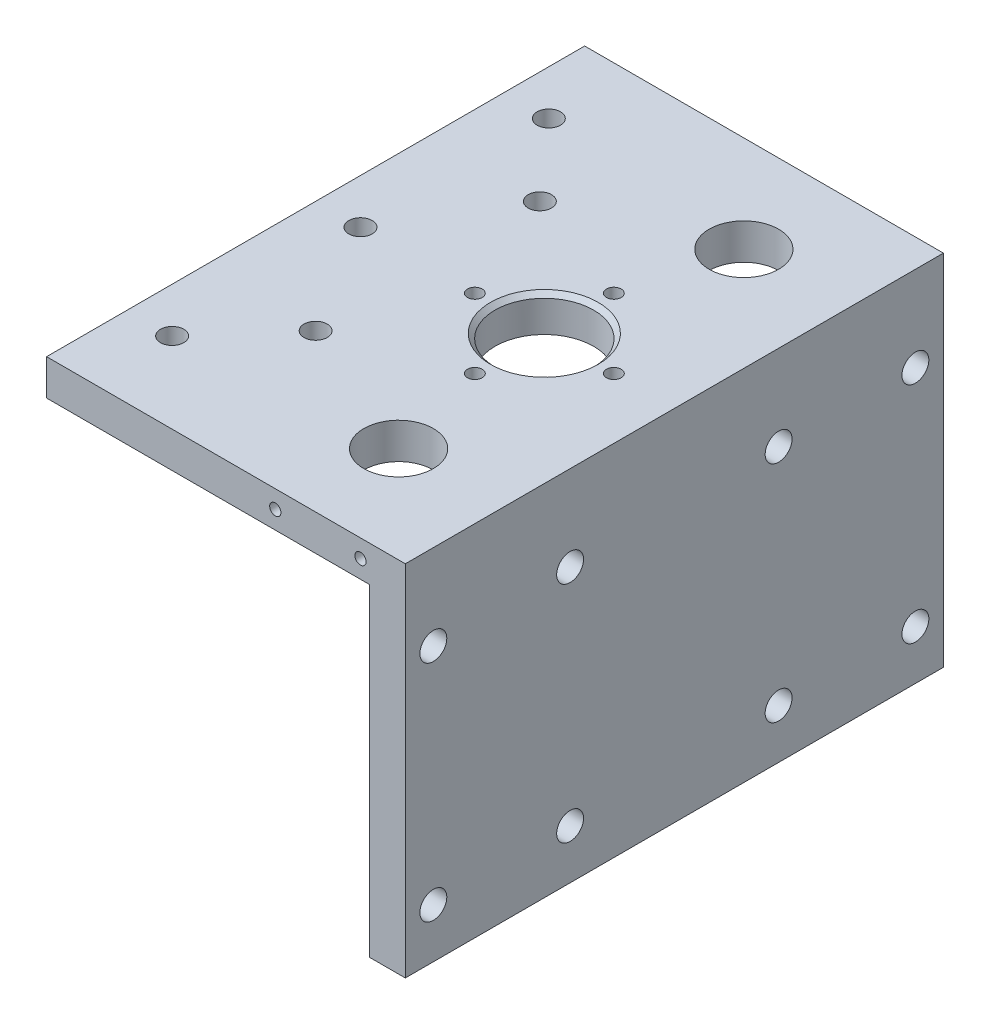
from build123d import *

# Parameters (mm, degrees)
ESTRUSIONE_ESTRUSIONE1_DEPTH = 120
TAGLIO_ESTRUSIONE2_REACH     = 166.924
SCHIZZO6_R                   = 7.75
TAGLIO_ESTRUSIONE3_REACH     = 166.924
SCHIZZO7_R                   = 11
M4_TAPPED_HOLE1_D            = 3.3
SCHIZZO12_R                  = 3
TAGLIO_ESTRUSIONE4_DEPTH     = 10
SCHIZZO14_R                  = 2.6
TAGLIO_ESTRUSIONE5_DEPTH     = 10
SMUSSO2_SIZE                 = 1
FORO_FILETTATO_M3_1_D        = 2.5
FORO_FILETTATO_M3_1_DEPTH    = 10
FORO_FILETTATO_M3_1_TIP      = 0.751075774


with BuildPart() as part:
    # Schizzo1 → Estrusione-Estrusione1 (new body)
    with BuildSketch(Plane.XY):
        Polygon((0, 0), (-80, 0), (-80, -8), (-8, -8), (-8, -80), (0, -80), align=None)
    extrude(amount=ESTRUSIONE_ESTRUSIONE1_DEPTH)

    # Schizzo6 → Taglio-Estrusione2 (cut, up to next)
    with BuildSketch(Plane(origin=(0, 0, 0), x_dir=(1, 0, 0), z_dir=(0, 1, 0)), mode=Mode.PRIVATE) as taglio_estrusione2_sk1:
        with Locations((-23, -21.5)):
            Circle(SCHIZZO6_R)
    taglio_estrusione2_tool1 = extrude(taglio_estrusione2_sk1.sketch, amount=-TAGLIO_ESTRUSIONE2_REACH, mode=Mode.PRIVATE) & part.part
    # Schizzo6 → Taglio-Estrusione2 (cut, up to next)
    with BuildSketch(Plane(origin=(0, 0, 0), x_dir=(1, 0, 0), z_dir=(0, 1, 0)), mode=Mode.PRIVATE) as taglio_estrusione2_sk2:
        with Locations((-23, -98.5)):
            Circle(SCHIZZO6_R)
    taglio_estrusione2_tool2 = extrude(taglio_estrusione2_sk2.sketch, amount=-TAGLIO_ESTRUSIONE2_REACH, mode=Mode.PRIVATE) & part.part
    add(taglio_estrusione2_tool1.solids().sort_by_distance((-23, 0, 21.5))[0], mode=Mode.SUBTRACT)
    add(taglio_estrusione2_tool2.solids().sort_by_distance((-23, 0, 98.5))[0], mode=Mode.SUBTRACT)

    # Schizzo7 → Taglio-Estrusione3 (cut, up to next)
    with BuildSketch(Plane(origin=(0, 0, 0), x_dir=(1, 0, 0), z_dir=(0, 1, 0)), mode=Mode.PRIVATE) as taglio_estrusione3_sk1:
        with Locations((-29, -60)):
            Circle(SCHIZZO7_R)
    taglio_estrusione3_tool1 = extrude(taglio_estrusione3_sk1.sketch, amount=-TAGLIO_ESTRUSIONE3_REACH, mode=Mode.PRIVATE) & part.part
    add(taglio_estrusione3_tool1.solids().sort_by_distance((-29, 0, 60))[0], mode=Mode.SUBTRACT)

    # M4 Tapped Hole1 (through all)
    with Locations(Plane(origin=(0, 0, 0), x_dir=(1, 0, 0), z_dir=(0, 1, 0))):
        with Locations((-29, -44.5), (-44.5, -60), (-29, -75.5), (-13.5, -60), (-29, -60)):
            Hole(M4_TAPPED_HOLE1_D / 2)

    # Schizzo12 → Taglio-Estrusione4 (cut)
    with BuildSketch(Plane(origin=(0, 0, 0), x_dir=(0, 0, -1), z_dir=(1, 0, 0))):
        with Locations((-113.75, -19)):
            Circle(SCHIZZO12_R)
        with Locations((-83.25, -19)):
            Circle(SCHIZZO12_R)
        with Locations((-36.75, -19)):
            Circle(SCHIZZO12_R)
        with Locations((-6.25, -19)):
            Circle(SCHIZZO12_R)
        with Locations((-83.25, -69)):
            Circle(SCHIZZO12_R)
        with Locations((-113.75, -69)):
            Circle(SCHIZZO12_R)
        with Locations((-6.25, -69)):
            Circle(SCHIZZO12_R)
        with Locations((-36.75, -69)):
            Circle(SCHIZZO12_R)
    extrude(amount=-TAGLIO_ESTRUSIONE4_DEPTH, mode=Mode.SUBTRACT)

    # Schizzo14 → Taglio-Estrusione5 (cut)
    with BuildSketch(Plane(origin=(0, 0, 0), x_dir=(1, 0, 0), z_dir=(0, 1, 0))):
        with Locations((-70, -18)):
            Circle(SCHIZZO14_R)
        with Locations((-70, -60)):
            Circle(SCHIZZO14_R)
        with Locations((-70, -102)):
            Circle(SCHIZZO14_R)
        with Locations((-55, -35)):
            Circle(SCHIZZO14_R)
        with Locations((-55, -85)):
            Circle(SCHIZZO14_R)
    extrude(amount=-TAGLIO_ESTRUSIONE5_DEPTH, mode=Mode.SUBTRACT)

    # Smusso2
    smusso2_edges = [part.edges().sort_by_distance(p)[0] for p in [
        (-40, 0, 60),
    ]]
    chamfer(smusso2_edges, length=SMUSSO2_SIZE)

    # Foro filettato M3-1
    with Locations(Plane.XY.offset(120)):
        with Locations((-10, -4), (-29, -4)):
            Hole(FORO_FILETTATO_M3_1_D / 2, depth=FORO_FILETTATO_M3_1_DEPTH)
            with Locations((0, 0, -(FORO_FILETTATO_M3_1_DEPTH + FORO_FILETTATO_M3_1_TIP / 2))):  # 118° drill point
                Cone(0, FORO_FILETTATO_M3_1_D / 2, FORO_FILETTATO_M3_1_TIP, mode=Mode.SUBTRACT)


solid = part.part
